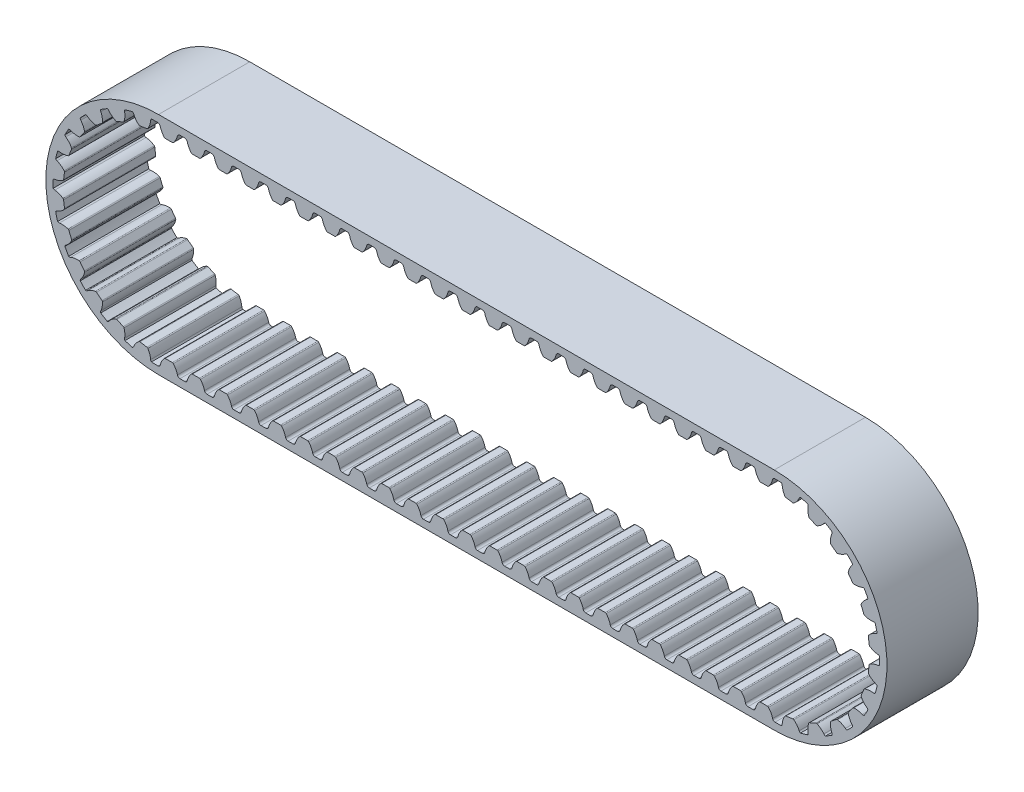
from build123d import *

# Parameters (mm, degrees)
EXTRUDE_2_DEPTH       = 10
EXTRUDE_3_DEPTH       = 10
PATTERN_CURVE_1_DEPTH = 10


# Read off the part's stored shape, not the designer's step: 曲線導出複製排列1
with BuildPart() as part:
    # 草圖2 → 填料-伸長2 (new body)
    with BuildSketch(Plane.XY):
        with BuildLine():
            Line((-33.75, 0.8), (33.75, 0.8))
            ThreePointArc((33.75, 0.8), (46.105, -11.555), (33.75, -23.91))
            Line((33.75, -23.91), (-33.75, -23.91))
            ThreePointArc((-33.75, -23.91), (-46.105, -11.555), (-33.75, 0.8))
        make_face()
        with BuildLine():
            Line((-33.75, 0), (33.75, 0))
            ThreePointArc((33.75, 0), (45.305, -11.555), (33.75, -23.11))
            Line((33.75, -23.11), (-33.75, -23.11))
            ThreePointArc((-33.75, -23.11), (-45.305, -11.555), (-33.75, 0))
        make_face(mode=Mode.SUBTRACT)
    extrude(amount=EXTRUDE_2_DEPTH)

    # 草圖3 → 填料-伸長3 (add)
    with BuildSketch(Plane.XY):
        with BuildLine():
            Line((-0.387655129, -1.11), (0.387655129, -1.11))
            ThreePointArc((0.387655129, -1.11), (0.449026444, -1.096870602), (0.49965418, -1.059780822))
            ThreePointArc((0.49965418, -1.059780822), (0.773682374, -0.664005968), (0.94382446, -0.213694013))
            ThreePointArc((0.94382446, -0.213694013), (1.042894551, -0.059811812), (1.215860333, 0))
            Line((1.215860333, 0), (-1.215860333, 0))
            ThreePointArc((-1.215860333, 0), (-1.042894551, -0.059811812), (-0.94382446, -0.213694013))
            ThreePointArc((-0.94382446, -0.213694013), (-0.773682374, -0.664005968), (-0.49965418, -1.059780822))
            ThreePointArc((-0.49965418, -1.059780822), (-0.449026444, -1.096870602), (-0.387655129, -1.11))
        make_face()
    extrude(amount=EXTRUDE_3_DEPTH)

    # 曲線導出複製排列1 outline → 曲線導出複製排列1 (add)
    with BuildSketch(Plane.XY):
        with BuildLine():
            ThreePointArc((3.909570264, -0.213694013), (4.008640354, -0.059811812), (4.181606137, 0))
            Line((4.181606137, 0), (1.74988547, 0))
            ThreePointArc((1.74988547, 0), (1.922851252, -0.059811812), (2.021921343, -0.213694013))
            ThreePointArc((2.021921343, -0.213694013), (2.19206343, -0.664005968), (2.466091623, -1.059780822))
            ThreePointArc((2.466091623, -1.059780822), (2.516719359, -1.096870602), (2.578090674, -1.11))
            Line((2.578090674, -1.11), (3.353400932, -1.11))
            ThreePointArc((3.353400932, -1.11), (3.414772248, -1.096870602), (3.465399984, -1.059780822))
            ThreePointArc((3.465399984, -1.059780822), (3.739428177, -0.664005968), (3.909570264, -0.213694013))
        make_face()
        with BuildLine():
            ThreePointArc((6.875316067, -0.213694013), (6.974386157, -0.059811812), (7.14735194, 0))
            Line((7.14735194, 0), (4.715631273, 0))
            ThreePointArc((4.715631273, 0), (4.888597055, -0.059811812), (4.987667146, -0.213694013))
            ThreePointArc((4.987667146, -0.213694013), (5.157809233, -0.664005968), (5.431837426, -1.059780822))
            ThreePointArc((5.431837426, -1.059780822), (5.482465162, -1.096870602), (5.543836478, -1.11))
            Line((5.543836478, -1.11), (6.319146735, -1.11))
            ThreePointArc((6.319146735, -1.11), (6.380518051, -1.096870602), (6.431145787, -1.059780822))
            ThreePointArc((6.431145787, -1.059780822), (6.70517398, -0.664005968), (6.875316067, -0.213694013))
        make_face()
        with BuildLine():
            ThreePointArc((9.84106187, -0.213694013), (9.940131961, -0.059811812), (10.113097743, 0))
            Line((10.113097743, 0), (7.681377076, 0))
            ThreePointArc((7.681377076, 0), (7.854342859, -0.059811812), (7.953412949, -0.213694013))
            ThreePointArc((7.953412949, -0.213694013), (8.123555036, -0.664005968), (8.397583229, -1.059780822))
            ThreePointArc((8.397583229, -1.059780822), (8.448210965, -1.096870602), (8.509582281, -1.11))
            Line((8.509582281, -1.11), (9.284892538, -1.11))
            ThreePointArc((9.284892538, -1.11), (9.346263854, -1.096870602), (9.39689159, -1.059780822))
            ThreePointArc((9.39689159, -1.059780822), (9.670919783, -0.664005968), (9.84106187, -0.213694013))
        make_face()
        with BuildLine():
            ThreePointArc((12.806807673, -0.213694013), (12.905877764, -0.059811812), (13.078843546, 0))
            Line((13.078843546, 0), (10.64712288, 0))
            ThreePointArc((10.64712288, 0), (10.820088662, -0.059811812), (10.919158752, -0.213694013))
            ThreePointArc((10.919158752, -0.213694013), (11.089300839, -0.664005968), (11.363329032, -1.059780822))
            ThreePointArc((11.363329032, -1.059780822), (11.413956768, -1.096870602), (11.475328084, -1.11))
            Line((11.475328084, -1.11), (12.250638342, -1.11))
            ThreePointArc((12.250638342, -1.11), (12.312009657, -1.096870602), (12.362637393, -1.059780822))
            ThreePointArc((12.362637393, -1.059780822), (12.636665586, -0.664005968), (12.806807673, -0.213694013))
        make_face()
        with BuildLine():
            ThreePointArc((15.772553476, -0.213694013), (15.871623567, -0.059811812), (16.044589349, 0))
            Line((16.044589349, 0), (13.612868683, 0))
            ThreePointArc((13.612868683, 0), (13.785834465, -0.059811812), (13.884904556, -0.213694013))
            ThreePointArc((13.884904556, -0.213694013), (14.055046643, -0.664005968), (14.329074836, -1.059780822))
            ThreePointArc((14.329074836, -1.059780822), (14.379702572, -1.096870602), (14.441073887, -1.11))
            Line((14.441073887, -1.11), (15.216384145, -1.11))
            ThreePointArc((15.216384145, -1.11), (15.27775546, -1.096870602), (15.328383196, -1.059780822))
            ThreePointArc((15.328383196, -1.059780822), (15.60241139, -0.664005968), (15.772553476, -0.213694013))
        make_face()
        with BuildLine():
            ThreePointArc((18.73829928, -0.213694013), (18.83736937, -0.059811812), (19.010335153, 0))
            Line((19.010335153, 0), (16.578614486, 0))
            ThreePointArc((16.578614486, 0), (16.751580268, -0.059811812), (16.850650359, -0.213694013))
            ThreePointArc((16.850650359, -0.213694013), (17.020792446, -0.664005968), (17.294820639, -1.059780822))
            ThreePointArc((17.294820639, -1.059780822), (17.345448375, -1.096870602), (17.40681969, -1.11))
            Line((17.40681969, -1.11), (18.182129948, -1.11))
            ThreePointArc((18.182129948, -1.11), (18.243501264, -1.096870602), (18.294129, -1.059780822))
            ThreePointArc((18.294129, -1.059780822), (18.568157193, -0.664005968), (18.73829928, -0.213694013))
        make_face()
        with BuildLine():
            ThreePointArc((21.704045083, -0.213694013), (21.803115173, -0.059811812), (21.976080956, 0))
            Line((21.976080956, 0), (19.544360289, 0))
            ThreePointArc((19.544360289, 0), (19.717326071, -0.059811812), (19.816396162, -0.213694013))
            ThreePointArc((19.816396162, -0.213694013), (19.986538249, -0.664005968), (20.260566442, -1.059780822))
            ThreePointArc((20.260566442, -1.059780822), (20.311194178, -1.096870602), (20.372565494, -1.11))
            Line((20.372565494, -1.11), (21.147875751, -1.11))
            ThreePointArc((21.147875751, -1.11), (21.209247067, -1.096870602), (21.259874803, -1.059780822))
            ThreePointArc((21.259874803, -1.059780822), (21.533902996, -0.664005968), (21.704045083, -0.213694013))
        make_face()
        with BuildLine():
            ThreePointArc((24.669790886, -0.213694013), (24.768860977, -0.059811812), (24.941826759, 0))
            Line((24.941826759, 0), (22.510106092, 0))
            ThreePointArc((22.510106092, 0), (22.683071875, -0.059811812), (22.782141965, -0.213694013))
            ThreePointArc((22.782141965, -0.213694013), (22.952284052, -0.664005968), (23.226312245, -1.059780822))
            ThreePointArc((23.226312245, -1.059780822), (23.276939981, -1.096870602), (23.338311297, -1.11))
            Line((23.338311297, -1.11), (24.113621554, -1.11))
            ThreePointArc((24.113621554, -1.11), (24.17499287, -1.096870602), (24.225620606, -1.059780822))
            ThreePointArc((24.225620606, -1.059780822), (24.499648799, -0.664005968), (24.669790886, -0.213694013))
        make_face()
        with BuildLine():
            ThreePointArc((27.635536689, -0.213694013), (27.73460678, -0.059811812), (27.907572562, 0))
            Line((27.907572562, 0), (25.475851896, 0))
            ThreePointArc((25.475851896, 0), (25.648817678, -0.059811812), (25.747887768, -0.213694013))
            ThreePointArc((25.747887768, -0.213694013), (25.918029855, -0.664005968), (26.192058048, -1.059780822))
            ThreePointArc((26.192058048, -1.059780822), (26.242685784, -1.096870602), (26.3040571, -1.11))
            Line((26.3040571, -1.11), (27.079367358, -1.11))
            ThreePointArc((27.079367358, -1.11), (27.140738673, -1.096870602), (27.191366409, -1.059780822))
            ThreePointArc((27.191366409, -1.059780822), (27.465394602, -0.664005968), (27.635536689, -0.213694013))
        make_face()
        with BuildLine():
            ThreePointArc((30.601282492, -0.213694013), (30.700352583, -0.059811812), (30.873318365, 0))
            Line((30.873318365, 0), (28.441597699, 0))
            ThreePointArc((28.441597699, 0), (28.614563481, -0.059811812), (28.713633572, -0.213694013))
            ThreePointArc((28.713633572, -0.213694013), (28.883775659, -0.664005968), (29.157803852, -1.059780822))
            ThreePointArc((29.157803852, -1.059780822), (29.208431588, -1.096870602), (29.269802903, -1.11))
            Line((29.269802903, -1.11), (30.045113161, -1.11))
            ThreePointArc((30.045113161, -1.11), (30.106484477, -1.096870602), (30.157112213, -1.059780822))
            ThreePointArc((30.157112213, -1.059780822), (30.431140406, -0.664005968), (30.601282492, -0.213694013))
        make_face()
        with BuildLine():
            ThreePointArc((33.567028296, -0.213694013), (33.661420863, -0.063567895), (33.827069714, -0.000257023))
            ThreePointArc((33.827069714, -0.000257023), (33.788535071, -6.4256e-05), (33.75, 0))
            Line((33.75, 0), (31.407343502, 0))
            ThreePointArc((31.407343502, 0), (31.580309284, -0.059811812), (31.679379375, -0.213694013))
            ThreePointArc((31.679379375, -0.213694013), (31.849521462, -0.664005968), (32.123549655, -1.059780822))
            ThreePointArc((32.123549655, -1.059780822), (32.174177391, -1.096870602), (32.235548706, -1.11))
            Line((32.235548706, -1.11), (33.010858964, -1.11))
            ThreePointArc((33.010858964, -1.11), (33.07223028, -1.096870602), (33.122858016, -1.059780822))
            ThreePointArc((33.122858016, -1.059780822), (33.396886209, -0.664005968), (33.567028296, -0.213694013))
        make_face()
        with BuildLine():
            ThreePointArc((36.479228277, -0.506591105), (36.535364864, -0.421225218), (36.618390772, -0.361682378))
            ThreePointArc((36.618390772, -0.361682378), (35.581196664, -0.146023544), (34.528610507, -0.026262399))
            ThreePointArc((34.528610507, -0.026262399), (34.588832258, -0.10879719), (34.615434067, -0.207442995))
            ThreePointArc((34.615434067, -0.207442995), (34.712062134, -0.679027773), (34.919906323, -1.113228163))
            ThreePointArc((34.919906323, -1.113228163), (34.964016403, -1.157872539), (35.022531451, -1.180561933))
            Line((35.022531451, -1.180561933), (35.788043911, -1.303430437))
            ThreePointArc((35.788043911, -1.303430437), (35.850720363, -1.300192873), (35.906586164, -1.271595116))
            ThreePointArc((35.906586164, -1.271595116), (36.23987243, -0.924248817), (36.479228277, -0.506591105))
        make_face()
        with BuildLine():
            ThreePointArc((39.194515614, -1.561338217), (39.270483831, -1.493019251), (39.365905235, -1.456503409))
            ThreePointArc((39.365905235, -1.456503409), (38.417433157, -0.984612461), (37.429729158, -0.601570477))
            ThreePointArc((37.429729158, -0.601570477), (37.467026344, -0.696689198), (37.46771504, -0.798856594))
            ThreePointArc((37.46771504, -0.798856594), (37.441463794, -1.279522859), (37.532275695, -1.752262094))
            ThreePointArc((37.532275695, -1.752262094), (37.563607649, -1.806641576), (37.614446074, -1.843442038))
            Line((37.614446074, -1.843442038), (38.323691412, -2.156614587))
            ThreePointArc((38.323691412, -2.156614587), (38.385136602, -2.16939379), (38.446432047, -2.155914623))
            ThreePointArc((38.446432047, -2.155914623), (38.85697613, -1.904552848), (39.194515614, -1.561338217))
        make_face()
        with BuildLine():
            ThreePointArc((41.553104067, -3.270822732), (41.643926834, -3.224026621), (41.745492177, -3.212930123))
            ThreePointArc((41.745492177, -3.212930123), (40.947881529, -2.515723121), (40.089769378, -1.894495395))
            ThreePointArc((40.089769378, -1.894495395), (40.101698463, -1.995966317), (40.076428927, -2.09496178))
            ThreePointArc((40.076428927, -2.09496178), (39.929018225, -2.553218554), (39.896848272, -3.033524997))
            ThreePointArc((39.896848272, -3.033524997), (39.913349378, -3.0940769), (39.953180487, -3.142577439))
            Line((39.953180487, -3.142577439), (40.559692307, -3.625536451))
            ThreePointArc((40.559692307, -3.625536451), (40.615880638, -3.653495187), (40.678589939, -3.656017701))
            ThreePointArc((40.678589939, -3.656017701), (41.139494934, -3.517108483), (41.553104067, -3.270822732))
        make_face()
        with BuildLine():
            ThreePointArc((43.400470088, -5.523047317), (43.500197129, -5.500839921), (43.60125233, -5.515889756))
            ThreePointArc((43.60125233, -5.515889756), (43.006758783, -4.639044403), (42.334457926, -3.820330834))
            ThreePointArc((42.334457926, -3.820330834), (42.320237373, -3.921506063), (42.270665145, -4.010843878))
            ThreePointArc((42.270665145, -4.010843878), (42.011752638, -4.416668347), (41.858708454, -4.873074596))
            ThreePointArc((41.858708454, -4.873074596), (41.859297639, -4.935831845), (41.885511885, -4.992854934))
            Line((41.885511885, -4.992854934), (42.349554405, -5.613959221))
            ThreePointArc((42.349554405, -5.613959221), (42.396804683, -5.655265766), (42.456819423, -5.673624699))
            ThreePointArc((42.456819423, -5.673624699), (42.937889018, -5.656268712), (43.400470088, -5.523047317))
        make_face()
        with BuildLine():
            ThreePointArc((44.615583002, -8.170456881), (44.717680673, -8.174293124), (44.811605073, -8.214503299))
            ThreePointArc((44.811605073, -8.214503299), (44.459177032, -7.215466349), (44.016733437, -6.252905174))
            ThreePointArc((44.016733437, -6.252905174), (43.977294909, -6.347156188), (43.906667726, -6.420983366))
            ThreePointArc((43.906667726, -6.420983366), (43.553216136, -6.747787832), (43.289324451, -7.150392309))
            ThreePointArc((43.289324451, -7.150392309), (43.273963114, -7.211243347), (43.284843065, -7.273053104))
            Line((43.284843065, -7.273053104), (43.576014416, -7.991610854))
            ThreePointArc((43.576014416, -7.991610854), (43.611231026, -8.043558999), (43.664619324, -8.07655156))
            ThreePointArc((43.664619324, -8.07655156), (44.134336117, -8.181885886), (44.615583002, -8.170456881))
        make_face()
        with BuildLine():
            ThreePointArc((45.118834364, -11.039605686), (45.216613708, -11.069234234), (45.297253826, -11.131970368))
            ThreePointArc((45.297253826, -11.131970368), (45.209980707, -10.076193993), (45.026381183, -9.032847663))
            ThreePointArc((45.026381183, -9.032847663), (44.964308506, -9.113999582), (44.877253528, -9.167479315))
            ThreePointArc((44.877253528, -9.167479315), (44.452419329, -9.393853097), (44.094969077, -9.716279063))
            ThreePointArc((44.094969077, -9.716279063), (44.06466362, -9.771237217), (44.059496473, -9.83378416))
            Line((44.059496473, -9.83378416), (44.158720486, -10.602718872))
            ThreePointArc((44.158720486, -10.602718872), (44.179596204, -10.66190522), (44.222860311, -10.707369893))
            ThreePointArc((44.222860311, -10.707369893), (44.650450682, -10.928493525), (45.118834364, -11.039605686))
        make_face()
        with BuildLine():
            ThreePointArc((44.877253528, -13.942520685), (44.964308506, -13.996000418), (45.026381183, -14.077152337))
            ThreePointArc((45.026381183, -14.077152337), (45.209980707, -13.033806007), (45.297253826, -11.978029632))
            ThreePointArc((45.297253826, -11.978029632), (45.216613708, -12.040765766), (45.118834364, -12.070394314))
            ThreePointArc((45.118834364, -12.070394314), (44.650450682, -12.181506475), (44.222860311, -12.402630107))
            ThreePointArc((44.222860311, -12.402630107), (44.179596204, -12.44809478), (44.158720486, -12.507281128))
            Line((44.158720486, -12.507281128), (44.059496473, -13.27621584))
            ThreePointArc((44.059496473, -13.27621584), (44.06466362, -13.338762783), (44.094969077, -13.393720937))
            ThreePointArc((44.094969077, -13.393720937), (44.452419329, -13.716146903), (44.877253528, -13.942520685))
        make_face()
        with BuildLine():
            ThreePointArc((43.906667726, -16.689016634), (43.977294909, -16.762843812), (44.016733437, -16.857094826))
            ThreePointArc((44.016733437, -16.857094826), (44.459177032, -15.894533651), (44.811605073, -14.895496701))
            ThreePointArc((44.811605073, -14.895496701), (44.717680673, -14.935706876), (44.615583002, -14.939543119))
            ThreePointArc((44.615583002, -14.939543119), (44.134336117, -14.928114114), (43.664619324, -15.03344844))
            ThreePointArc((43.664619324, -15.03344844), (43.611231026, -15.066441001), (43.576014416, -15.118389146))
            Line((43.576014416, -15.118389146), (43.284843065, -15.836946896))
            ThreePointArc((43.284843065, -15.836946896), (43.273963114, -15.898756653), (43.289324451, -15.959607691))
            ThreePointArc((43.289324451, -15.959607691), (43.553216136, -16.362212168), (43.906667726, -16.689016634))
        make_face()
        with BuildLine():
            ThreePointArc((42.270665145, -19.099156122), (42.320237373, -19.188493937), (42.334457926, -19.289669166))
            ThreePointArc((42.334457926, -19.289669166), (43.006758783, -18.470955597), (43.60125233, -17.594110244))
            ThreePointArc((43.60125233, -17.594110244), (43.500197129, -17.609160079), (43.400470088, -17.586952683))
            ThreePointArc((43.400470088, -17.586952683), (42.937889018, -17.453731288), (42.456819423, -17.436375301))
            ThreePointArc((42.456819423, -17.436375301), (42.396804683, -17.454734234), (42.349554405, -17.496040779))
            Line((42.349554405, -17.496040779), (41.885511885, -18.117145066))
            ThreePointArc((41.885511885, -18.117145066), (41.859297639, -18.174168155), (41.858708454, -18.236925404))
            ThreePointArc((41.858708454, -18.236925404), (42.011752638, -18.693331653), (42.270665145, -19.099156122))
        make_face()
        with BuildLine():
            ThreePointArc((40.076428927, -21.01503822), (40.101698463, -21.114033683), (40.089769378, -21.215504605))
            ThreePointArc((40.089769378, -21.215504605), (40.947881529, -20.594276879), (41.745492177, -19.897069877))
            ThreePointArc((41.745492177, -19.897069877), (41.643926834, -19.885973379), (41.553104067, -19.839177268))
            ThreePointArc((41.553104067, -19.839177268), (41.139494934, -19.592891517), (40.678589939, -19.453982299))
            ThreePointArc((40.678589939, -19.453982299), (40.615880638, -19.456504813), (40.559692307, -19.484463549))
            Line((40.559692307, -19.484463549), (39.953180487, -19.967422561))
            ThreePointArc((39.953180487, -19.967422561), (39.913349378, -20.0159231), (39.896848272, -20.076475003))
            ThreePointArc((39.896848272, -20.076475003), (39.929018225, -20.556781446), (40.076428927, -21.01503822))
        make_face()
        with BuildLine():
            ThreePointArc((37.46771504, -22.311143406), (37.467026344, -22.413310802), (37.429729158, -22.508429523))
            ThreePointArc((37.429729158, -22.508429523), (38.417433157, -22.125387539), (39.365905235, -21.653496591))
            ThreePointArc((39.365905235, -21.653496591), (39.270483831, -21.616980749), (39.194515614, -21.548661783))
            ThreePointArc((39.194515614, -21.548661783), (38.85697613, -21.205447152), (38.446432047, -20.954085377))
            ThreePointArc((38.446432047, -20.954085377), (38.385136602, -20.94060621), (38.323691412, -20.953385413))
            Line((38.323691412, -20.953385413), (37.614446074, -21.266557962))
            ThreePointArc((37.614446074, -21.266557962), (37.563607649, -21.303358424), (37.532275695, -21.357737906))
            ThreePointArc((37.532275695, -21.357737906), (37.441463794, -21.830477141), (37.46771504, -22.311143406))
        make_face()
        with BuildLine():
            ThreePointArc((34.615434067, -22.902557005), (34.588832258, -23.00120281), (34.528610507, -23.083737601))
            ThreePointArc((34.528610507, -23.083737601), (35.581196664, -22.963976456), (36.618390772, -22.748317622))
            ThreePointArc((36.618390772, -22.748317622), (36.535364864, -22.688774782), (36.479228277, -22.603408895))
            ThreePointArc((36.479228277, -22.603408895), (36.23987243, -22.185751183), (35.906586164, -21.838404884))
            ThreePointArc((35.906586164, -21.838404884), (35.850720363, -21.809807127), (35.788043911, -21.806569563))
            Line((35.788043911, -21.806569563), (35.022531451, -21.929438067))
            ThreePointArc((35.022531451, -21.929438067), (34.964016403, -21.952127461), (34.919906323, -21.996771837))
            ThreePointArc((34.919906323, -21.996771837), (34.712062134, -22.430972227), (34.615434067, -22.902557005))
        make_face()
        with BuildLine():
            ThreePointArc((31.679379375, -22.896305987), (31.580309284, -23.050188188), (31.407343502, -23.11))
            Line((31.407343502, -23.11), (33.75, -23.11))
            ThreePointArc((33.75, -23.11), (33.788535071, -23.109935744), (33.827069714, -23.109742977))
            ThreePointArc((33.827069714, -23.109742977), (33.661420863, -23.046432105), (33.567028296, -22.896305987))
            ThreePointArc((33.567028296, -22.896305987), (33.396886209, -22.445994032), (33.122858016, -22.050219178))
            ThreePointArc((33.122858016, -22.050219178), (33.07223028, -22.013129398), (33.010858964, -22))
            Line((33.010858964, -22), (32.235548706, -22))
            ThreePointArc((32.235548706, -22), (32.174177391, -22.013129398), (32.123549655, -22.050219178))
            ThreePointArc((32.123549655, -22.050219178), (31.849521462, -22.445994032), (31.679379375, -22.896305987))
        make_face()
        with BuildLine():
            ThreePointArc((28.713633572, -22.896305987), (28.614563481, -23.050188188), (28.441597699, -23.11))
            Line((28.441597699, -23.11), (30.873318365, -23.11))
            ThreePointArc((30.873318365, -23.11), (30.700352583, -23.050188188), (30.601282492, -22.896305987))
            ThreePointArc((30.601282492, -22.896305987), (30.431140406, -22.445994032), (30.157112213, -22.050219178))
            ThreePointArc((30.157112213, -22.050219178), (30.106484477, -22.013129398), (30.045113161, -22))
            Line((30.045113161, -22), (29.269802903, -22))
            ThreePointArc((29.269802903, -22), (29.208431588, -22.013129398), (29.157803852, -22.050219178))
            ThreePointArc((29.157803852, -22.050219178), (28.883775659, -22.445994032), (28.713633572, -22.896305987))
        make_face()
        with BuildLine():
            ThreePointArc((25.747887768, -22.896305987), (25.648817678, -23.050188188), (25.475851896, -23.11))
            Line((25.475851896, -23.11), (27.907572562, -23.11))
            ThreePointArc((27.907572562, -23.11), (27.73460678, -23.050188188), (27.635536689, -22.896305987))
            ThreePointArc((27.635536689, -22.896305987), (27.465394602, -22.445994032), (27.191366409, -22.050219178))
            ThreePointArc((27.191366409, -22.050219178), (27.140738673, -22.013129398), (27.079367358, -22))
            Line((27.079367358, -22), (26.3040571, -22))
            ThreePointArc((26.3040571, -22), (26.242685784, -22.013129398), (26.192058048, -22.050219178))
            ThreePointArc((26.192058048, -22.050219178), (25.918029855, -22.445994032), (25.747887768, -22.896305987))
        make_face()
        with BuildLine():
            ThreePointArc((22.782141965, -22.896305987), (22.683071875, -23.050188188), (22.510106092, -23.11))
            Line((22.510106092, -23.11), (24.941826759, -23.11))
            ThreePointArc((24.941826759, -23.11), (24.768860977, -23.050188188), (24.669790886, -22.896305987))
            ThreePointArc((24.669790886, -22.896305987), (24.499648799, -22.445994032), (24.225620606, -22.050219178))
            ThreePointArc((24.225620606, -22.050219178), (24.17499287, -22.013129398), (24.113621554, -22))
            Line((24.113621554, -22), (23.338311297, -22))
            ThreePointArc((23.338311297, -22), (23.276939981, -22.013129398), (23.226312245, -22.050219178))
            ThreePointArc((23.226312245, -22.050219178), (22.952284052, -22.445994032), (22.782141965, -22.896305987))
        make_face()
        with BuildLine():
            ThreePointArc((19.816396162, -22.896305987), (19.717326071, -23.050188188), (19.544360289, -23.11))
            Line((19.544360289, -23.11), (21.976080956, -23.11))
            ThreePointArc((21.976080956, -23.11), (21.803115173, -23.050188188), (21.704045083, -22.896305987))
            ThreePointArc((21.704045083, -22.896305987), (21.533902996, -22.445994032), (21.259874803, -22.050219178))
            ThreePointArc((21.259874803, -22.050219178), (21.209247067, -22.013129398), (21.147875751, -22))
            Line((21.147875751, -22), (20.372565494, -22))
            ThreePointArc((20.372565494, -22), (20.311194178, -22.013129398), (20.260566442, -22.050219178))
            ThreePointArc((20.260566442, -22.050219178), (19.986538249, -22.445994032), (19.816396162, -22.896305987))
        make_face()
        with BuildLine():
            ThreePointArc((16.850650359, -22.896305987), (16.751580268, -23.050188188), (16.578614486, -23.11))
            Line((16.578614486, -23.11), (19.010335153, -23.11))
            ThreePointArc((19.010335153, -23.11), (18.83736937, -23.050188188), (18.73829928, -22.896305987))
            ThreePointArc((18.73829928, -22.896305987), (18.568157193, -22.445994032), (18.294129, -22.050219178))
            ThreePointArc((18.294129, -22.050219178), (18.243501264, -22.013129398), (18.182129948, -22))
            Line((18.182129948, -22), (17.40681969, -22))
            ThreePointArc((17.40681969, -22), (17.345448375, -22.013129398), (17.294820639, -22.050219178))
            ThreePointArc((17.294820639, -22.050219178), (17.020792446, -22.445994032), (16.850650359, -22.896305987))
        make_face()
        with BuildLine():
            ThreePointArc((13.884904556, -22.896305987), (13.785834465, -23.050188188), (13.612868683, -23.11))
            Line((13.612868683, -23.11), (16.044589349, -23.11))
            ThreePointArc((16.044589349, -23.11), (15.871623567, -23.050188188), (15.772553476, -22.896305987))
            ThreePointArc((15.772553476, -22.896305987), (15.60241139, -22.445994032), (15.328383196, -22.050219178))
            ThreePointArc((15.328383196, -22.050219178), (15.27775546, -22.013129398), (15.216384145, -22))
            Line((15.216384145, -22), (14.441073887, -22))
            ThreePointArc((14.441073887, -22), (14.379702572, -22.013129398), (14.329074836, -22.050219178))
            ThreePointArc((14.329074836, -22.050219178), (14.055046643, -22.445994032), (13.884904556, -22.896305987))
        make_face()
        with BuildLine():
            ThreePointArc((10.919158752, -22.896305987), (10.820088662, -23.050188188), (10.64712288, -23.11))
            Line((10.64712288, -23.11), (13.078843546, -23.11))
            ThreePointArc((13.078843546, -23.11), (12.905877764, -23.050188188), (12.806807673, -22.896305987))
            ThreePointArc((12.806807673, -22.896305987), (12.636665586, -22.445994032), (12.362637393, -22.050219178))
            ThreePointArc((12.362637393, -22.050219178), (12.312009657, -22.013129398), (12.250638342, -22))
            Line((12.250638342, -22), (11.475328084, -22))
            ThreePointArc((11.475328084, -22), (11.413956768, -22.013129398), (11.363329032, -22.050219178))
            ThreePointArc((11.363329032, -22.050219178), (11.089300839, -22.445994032), (10.919158752, -22.896305987))
        make_face()
        with BuildLine():
            ThreePointArc((7.953412949, -22.896305987), (7.854342859, -23.050188188), (7.681377076, -23.11))
            Line((7.681377076, -23.11), (10.113097743, -23.11))
            ThreePointArc((10.113097743, -23.11), (9.940131961, -23.050188188), (9.84106187, -22.896305987))
            ThreePointArc((9.84106187, -22.896305987), (9.670919783, -22.445994032), (9.39689159, -22.050219178))
            ThreePointArc((9.39689159, -22.050219178), (9.346263854, -22.013129398), (9.284892538, -22))
            Line((9.284892538, -22), (8.509582281, -22))
            ThreePointArc((8.509582281, -22), (8.448210965, -22.013129398), (8.397583229, -22.050219178))
            ThreePointArc((8.397583229, -22.050219178), (8.123555036, -22.445994032), (7.953412949, -22.896305987))
        make_face()
        with BuildLine():
            ThreePointArc((4.987667146, -22.896305987), (4.888597055, -23.050188188), (4.715631273, -23.11))
            Line((4.715631273, -23.11), (7.14735194, -23.11))
            ThreePointArc((7.14735194, -23.11), (6.974386157, -23.050188188), (6.875316067, -22.896305987))
            ThreePointArc((6.875316067, -22.896305987), (6.70517398, -22.445994032), (6.431145787, -22.050219178))
            ThreePointArc((6.431145787, -22.050219178), (6.380518051, -22.013129398), (6.319146735, -22))
            Line((6.319146735, -22), (5.543836478, -22))
            ThreePointArc((5.543836478, -22), (5.482465162, -22.013129398), (5.431837426, -22.050219178))
            ThreePointArc((5.431837426, -22.050219178), (5.157809233, -22.445994032), (4.987667146, -22.896305987))
        make_face()
        with BuildLine():
            ThreePointArc((2.021921343, -22.896305987), (1.922851252, -23.050188188), (1.74988547, -23.11))
            Line((1.74988547, -23.11), (4.181606137, -23.11))
            ThreePointArc((4.181606137, -23.11), (4.008640354, -23.050188188), (3.909570264, -22.896305987))
            ThreePointArc((3.909570264, -22.896305987), (3.739428177, -22.445994032), (3.465399984, -22.050219178))
            ThreePointArc((3.465399984, -22.050219178), (3.414772248, -22.013129398), (3.353400932, -22))
            Line((3.353400932, -22), (2.578090674, -22))
            ThreePointArc((2.578090674, -22), (2.516719359, -22.013129398), (2.466091623, -22.050219178))
            ThreePointArc((2.466091623, -22.050219178), (2.19206343, -22.445994032), (2.021921343, -22.896305987))
        make_face()
        with BuildLine():
            ThreePointArc((-0.94382446, -22.896305987), (-1.042894551, -23.050188188), (-1.215860333, -23.11))
            Line((-1.215860333, -23.11), (1.215860333, -23.11))
            ThreePointArc((1.215860333, -23.11), (1.042894551, -23.050188188), (0.94382446, -22.896305987))
            ThreePointArc((0.94382446, -22.896305987), (0.773682374, -22.445994032), (0.49965418, -22.050219178))
            ThreePointArc((0.49965418, -22.050219178), (0.449026444, -22.013129398), (0.387655129, -22))
            Line((0.387655129, -22), (-0.387655129, -22))
            ThreePointArc((-0.387655129, -22), (-0.449026444, -22.013129398), (-0.49965418, -22.050219178))
            ThreePointArc((-0.49965418, -22.050219178), (-0.773682374, -22.445994032), (-0.94382446, -22.896305987))
        make_face()
        with BuildLine():
            ThreePointArc((-3.909570264, -22.896305987), (-4.008640354, -23.050188188), (-4.181606137, -23.11))
            Line((-4.181606137, -23.11), (-1.74988547, -23.11))
            ThreePointArc((-1.74988547, -23.11), (-1.922851252, -23.050188188), (-2.021921343, -22.896305987))
            ThreePointArc((-2.021921343, -22.896305987), (-2.19206343, -22.445994032), (-2.466091623, -22.050219178))
            ThreePointArc((-2.466091623, -22.050219178), (-2.516719359, -22.013129398), (-2.578090674, -22))
            Line((-2.578090674, -22), (-3.353400932, -22))
            ThreePointArc((-3.353400932, -22), (-3.414772248, -22.013129398), (-3.465399984, -22.050219178))
            ThreePointArc((-3.465399984, -22.050219178), (-3.739428177, -22.445994032), (-3.909570264, -22.896305987))
        make_face()
        with BuildLine():
            ThreePointArc((-6.875316067, -22.896305987), (-6.974386157, -23.050188188), (-7.14735194, -23.11))
            Line((-7.14735194, -23.11), (-4.715631273, -23.11))
            ThreePointArc((-4.715631273, -23.11), (-4.888597055, -23.050188188), (-4.987667146, -22.896305987))
            ThreePointArc((-4.987667146, -22.896305987), (-5.157809233, -22.445994032), (-5.431837426, -22.050219178))
            ThreePointArc((-5.431837426, -22.050219178), (-5.482465162, -22.013129398), (-5.543836478, -22))
            Line((-5.543836478, -22), (-6.319146735, -22))
            ThreePointArc((-6.319146735, -22), (-6.380518051, -22.013129398), (-6.431145787, -22.050219178))
            ThreePointArc((-6.431145787, -22.050219178), (-6.70517398, -22.445994032), (-6.875316067, -22.896305987))
        make_face()
        with BuildLine():
            ThreePointArc((-9.84106187, -22.896305987), (-9.940131961, -23.050188188), (-10.113097743, -23.11))
            Line((-10.113097743, -23.11), (-7.681377076, -23.11))
            ThreePointArc((-7.681377076, -23.11), (-7.854342859, -23.050188188), (-7.953412949, -22.896305987))
            ThreePointArc((-7.953412949, -22.896305987), (-8.123555036, -22.445994032), (-8.397583229, -22.050219178))
            ThreePointArc((-8.397583229, -22.050219178), (-8.448210965, -22.013129398), (-8.509582281, -22))
            Line((-8.509582281, -22), (-9.284892538, -22))
            ThreePointArc((-9.284892538, -22), (-9.346263854, -22.013129398), (-9.39689159, -22.050219178))
            ThreePointArc((-9.39689159, -22.050219178), (-9.670919783, -22.445994032), (-9.84106187, -22.896305987))
        make_face()
        with BuildLine():
            ThreePointArc((-12.806807673, -22.896305987), (-12.905877764, -23.050188188), (-13.078843546, -23.11))
            Line((-13.078843546, -23.11), (-10.64712288, -23.11))
            ThreePointArc((-10.64712288, -23.11), (-10.820088662, -23.050188188), (-10.919158752, -22.896305987))
            ThreePointArc((-10.919158752, -22.896305987), (-11.089300839, -22.445994032), (-11.363329032, -22.050219178))
            ThreePointArc((-11.363329032, -22.050219178), (-11.413956768, -22.013129398), (-11.475328084, -22))
            Line((-11.475328084, -22), (-12.250638342, -22))
            ThreePointArc((-12.250638342, -22), (-12.312009657, -22.013129398), (-12.362637393, -22.050219178))
            ThreePointArc((-12.362637393, -22.050219178), (-12.636665586, -22.445994032), (-12.806807673, -22.896305987))
        make_face()
        with BuildLine():
            ThreePointArc((-15.772553476, -22.896305987), (-15.871623567, -23.050188188), (-16.044589349, -23.11))
            Line((-16.044589349, -23.11), (-13.612868683, -23.11))
            ThreePointArc((-13.612868683, -23.11), (-13.785834465, -23.050188188), (-13.884904556, -22.896305987))
            ThreePointArc((-13.884904556, -22.896305987), (-14.055046643, -22.445994032), (-14.329074836, -22.050219178))
            ThreePointArc((-14.329074836, -22.050219178), (-14.379702572, -22.013129398), (-14.441073887, -22))
            Line((-14.441073887, -22), (-15.216384145, -22))
            ThreePointArc((-15.216384145, -22), (-15.27775546, -22.013129398), (-15.328383196, -22.050219178))
            ThreePointArc((-15.328383196, -22.050219178), (-15.60241139, -22.445994032), (-15.772553476, -22.896305987))
        make_face()
        with BuildLine():
            ThreePointArc((-18.73829928, -22.896305987), (-18.83736937, -23.050188188), (-19.010335153, -23.11))
            Line((-19.010335153, -23.11), (-16.578614486, -23.11))
            ThreePointArc((-16.578614486, -23.11), (-16.751580268, -23.050188188), (-16.850650359, -22.896305987))
            ThreePointArc((-16.850650359, -22.896305987), (-17.020792446, -22.445994032), (-17.294820639, -22.050219178))
            ThreePointArc((-17.294820639, -22.050219178), (-17.345448375, -22.013129398), (-17.40681969, -22))
            Line((-17.40681969, -22), (-18.182129948, -22))
            ThreePointArc((-18.182129948, -22), (-18.243501264, -22.013129398), (-18.294129, -22.050219178))
            ThreePointArc((-18.294129, -22.050219178), (-18.568157193, -22.445994032), (-18.73829928, -22.896305987))
        make_face()
        with BuildLine():
            ThreePointArc((-21.704045083, -22.896305987), (-21.803115173, -23.050188188), (-21.976080956, -23.11))
            Line((-21.976080956, -23.11), (-19.544360289, -23.11))
            ThreePointArc((-19.544360289, -23.11), (-19.717326071, -23.050188188), (-19.816396162, -22.896305987))
            ThreePointArc((-19.816396162, -22.896305987), (-19.986538249, -22.445994032), (-20.260566442, -22.050219178))
            ThreePointArc((-20.260566442, -22.050219178), (-20.311194178, -22.013129398), (-20.372565494, -22))
            Line((-20.372565494, -22), (-21.147875751, -22))
            ThreePointArc((-21.147875751, -22), (-21.209247067, -22.013129398), (-21.259874803, -22.050219178))
            ThreePointArc((-21.259874803, -22.050219178), (-21.533902996, -22.445994032), (-21.704045083, -22.896305987))
        make_face()
        with BuildLine():
            ThreePointArc((-24.669790886, -22.896305987), (-24.768860977, -23.050188188), (-24.941826759, -23.11))
            Line((-24.941826759, -23.11), (-22.510106092, -23.11))
            ThreePointArc((-22.510106092, -23.11), (-22.683071875, -23.050188188), (-22.782141965, -22.896305987))
            ThreePointArc((-22.782141965, -22.896305987), (-22.952284052, -22.445994032), (-23.226312245, -22.050219178))
            ThreePointArc((-23.226312245, -22.050219178), (-23.276939981, -22.013129398), (-23.338311297, -22))
            Line((-23.338311297, -22), (-24.113621554, -22))
            ThreePointArc((-24.113621554, -22), (-24.17499287, -22.013129398), (-24.225620606, -22.050219178))
            ThreePointArc((-24.225620606, -22.050219178), (-24.499648799, -22.445994032), (-24.669790886, -22.896305987))
        make_face()
        with BuildLine():
            ThreePointArc((-27.635536689, -22.896305987), (-27.73460678, -23.050188188), (-27.907572562, -23.11))
            Line((-27.907572562, -23.11), (-25.475851896, -23.11))
            ThreePointArc((-25.475851896, -23.11), (-25.648817678, -23.050188188), (-25.747887768, -22.896305987))
            ThreePointArc((-25.747887768, -22.896305987), (-25.918029855, -22.445994032), (-26.192058048, -22.050219178))
            ThreePointArc((-26.192058048, -22.050219178), (-26.242685784, -22.013129398), (-26.3040571, -22))
            Line((-26.3040571, -22), (-27.079367358, -22))
            ThreePointArc((-27.079367358, -22), (-27.140738673, -22.013129398), (-27.191366409, -22.050219178))
            ThreePointArc((-27.191366409, -22.050219178), (-27.465394602, -22.445994032), (-27.635536689, -22.896305987))
        make_face()
        with BuildLine():
            ThreePointArc((-30.601282492, -22.896305987), (-30.700352583, -23.050188188), (-30.873318365, -23.11))
            Line((-30.873318365, -23.11), (-28.441597699, -23.11))
            ThreePointArc((-28.441597699, -23.11), (-28.614563481, -23.050188188), (-28.713633572, -22.896305987))
            ThreePointArc((-28.713633572, -22.896305987), (-28.883775659, -22.445994032), (-29.157803852, -22.050219178))
            ThreePointArc((-29.157803852, -22.050219178), (-29.208431588, -22.013129398), (-29.269802903, -22))
            Line((-29.269802903, -22), (-30.045113161, -22))
            ThreePointArc((-30.045113161, -22), (-30.106484477, -22.013129398), (-30.157112213, -22.050219178))
            ThreePointArc((-30.157112213, -22.050219178), (-30.431140406, -22.445994032), (-30.601282492, -22.896305987))
        make_face()
        with BuildLine():
            ThreePointArc((-33.567028296, -22.896305987), (-33.661420863, -23.046432105), (-33.827069714, -23.109742977))
            ThreePointArc((-33.827069714, -23.109742977), (-33.788535071, -23.109935744), (-33.75, -23.11))
            Line((-33.75, -23.11), (-31.407343502, -23.11))
            ThreePointArc((-31.407343502, -23.11), (-31.580309284, -23.050188188), (-31.679379375, -22.896305987))
            ThreePointArc((-31.679379375, -22.896305987), (-31.849521462, -22.445994032), (-32.123549655, -22.050219178))
            ThreePointArc((-32.123549655, -22.050219178), (-32.174177391, -22.013129398), (-32.235548706, -22))
            Line((-32.235548706, -22), (-33.010858964, -22))
            ThreePointArc((-33.010858964, -22), (-33.07223028, -22.013129398), (-33.122858016, -22.050219178))
            ThreePointArc((-33.122858016, -22.050219178), (-33.396886209, -22.445994032), (-33.567028296, -22.896305987))
        make_face()
        with BuildLine():
            ThreePointArc((-36.479228277, -22.603408895), (-36.535364864, -22.688774782), (-36.618390772, -22.748317622))
            ThreePointArc((-36.618390772, -22.748317622), (-35.581196664, -22.963976456), (-34.528610507, -23.083737601))
            ThreePointArc((-34.528610507, -23.083737601), (-34.588832258, -23.00120281), (-34.615434067, -22.902557005))
            ThreePointArc((-34.615434067, -22.902557005), (-34.712062134, -22.430972227), (-34.919906323, -21.996771837))
            ThreePointArc((-34.919906323, -21.996771837), (-34.964016403, -21.952127461), (-35.022531451, -21.929438067))
            Line((-35.022531451, -21.929438067), (-35.788043911, -21.806569563))
            ThreePointArc((-35.788043911, -21.806569563), (-35.850720363, -21.809807127), (-35.906586164, -21.838404884))
            ThreePointArc((-35.906586164, -21.838404884), (-36.23987243, -22.185751183), (-36.479228277, -22.603408895))
        make_face()
        with BuildLine():
            ThreePointArc((-39.194515614, -21.548661783), (-39.270483831, -21.616980749), (-39.365905235, -21.653496591))
            ThreePointArc((-39.365905235, -21.653496591), (-38.417433157, -22.125387539), (-37.429729158, -22.508429523))
            ThreePointArc((-37.429729158, -22.508429523), (-37.467026344, -22.413310802), (-37.46771504, -22.311143406))
            ThreePointArc((-37.46771504, -22.311143406), (-37.441463794, -21.830477141), (-37.532275695, -21.357737906))
            ThreePointArc((-37.532275695, -21.357737906), (-37.563607649, -21.303358424), (-37.614446074, -21.266557962))
            Line((-37.614446074, -21.266557962), (-38.323691412, -20.953385413))
            ThreePointArc((-38.323691412, -20.953385413), (-38.385136602, -20.94060621), (-38.446432047, -20.954085377))
            ThreePointArc((-38.446432047, -20.954085377), (-38.85697613, -21.205447152), (-39.194515614, -21.548661783))
        make_face()
        with BuildLine():
            ThreePointArc((-41.553104067, -19.839177268), (-41.643926834, -19.885973379), (-41.745492177, -19.897069877))
            ThreePointArc((-41.745492177, -19.897069877), (-40.947881529, -20.594276879), (-40.089769378, -21.215504605))
            ThreePointArc((-40.089769378, -21.215504605), (-40.101698463, -21.114033683), (-40.076428927, -21.01503822))
            ThreePointArc((-40.076428927, -21.01503822), (-39.929018225, -20.556781446), (-39.896848272, -20.076475003))
            ThreePointArc((-39.896848272, -20.076475003), (-39.913349378, -20.0159231), (-39.953180487, -19.967422561))
            Line((-39.953180487, -19.967422561), (-40.559692307, -19.484463549))
            ThreePointArc((-40.559692307, -19.484463549), (-40.615880638, -19.456504813), (-40.678589939, -19.453982299))
            ThreePointArc((-40.678589939, -19.453982299), (-41.139494934, -19.592891517), (-41.553104067, -19.839177268))
        make_face()
        with BuildLine():
            ThreePointArc((-43.400470088, -17.586952683), (-43.500197129, -17.609160079), (-43.60125233, -17.594110244))
            ThreePointArc((-43.60125233, -17.594110244), (-43.006758783, -18.470955597), (-42.334457926, -19.289669166))
            ThreePointArc((-42.334457926, -19.289669166), (-42.320237373, -19.188493937), (-42.270665145, -19.099156122))
            ThreePointArc((-42.270665145, -19.099156122), (-42.011752638, -18.693331653), (-41.858708454, -18.236925404))
            ThreePointArc((-41.858708454, -18.236925404), (-41.859297639, -18.174168155), (-41.885511885, -18.117145066))
            Line((-41.885511885, -18.117145066), (-42.349554405, -17.496040779))
            ThreePointArc((-42.349554405, -17.496040779), (-42.396804683, -17.454734234), (-42.456819423, -17.436375301))
            ThreePointArc((-42.456819423, -17.436375301), (-42.937889018, -17.453731288), (-43.400470088, -17.586952683))
        make_face()
        with BuildLine():
            ThreePointArc((-44.615583002, -14.939543119), (-44.717680673, -14.935706876), (-44.811605073, -14.895496701))
            ThreePointArc((-44.811605073, -14.895496701), (-44.459177032, -15.894533651), (-44.016733437, -16.857094826))
            ThreePointArc((-44.016733437, -16.857094826), (-43.977294909, -16.762843812), (-43.906667726, -16.689016634))
            ThreePointArc((-43.906667726, -16.689016634), (-43.553216136, -16.362212168), (-43.289324451, -15.959607691))
            ThreePointArc((-43.289324451, -15.959607691), (-43.273963114, -15.898756653), (-43.284843065, -15.836946896))
            Line((-43.284843065, -15.836946896), (-43.576014416, -15.118389146))
            ThreePointArc((-43.576014416, -15.118389146), (-43.611231026, -15.066441001), (-43.664619324, -15.03344844))
            ThreePointArc((-43.664619324, -15.03344844), (-44.134336117, -14.928114114), (-44.615583002, -14.939543119))
        make_face()
        with BuildLine():
            ThreePointArc((-45.118834364, -12.070394314), (-45.216613708, -12.040765766), (-45.297253826, -11.978029632))
            ThreePointArc((-45.297253826, -11.978029632), (-45.209980707, -13.033806007), (-45.026381183, -14.077152337))
            ThreePointArc((-45.026381183, -14.077152337), (-44.964308506, -13.996000418), (-44.877253528, -13.942520685))
            ThreePointArc((-44.877253528, -13.942520685), (-44.452419329, -13.716146903), (-44.094969077, -13.393720937))
            ThreePointArc((-44.094969077, -13.393720937), (-44.06466362, -13.338762783), (-44.059496473, -13.27621584))
            Line((-44.059496473, -13.27621584), (-44.158720486, -12.507281128))
            ThreePointArc((-44.158720486, -12.507281128), (-44.179596204, -12.44809478), (-44.222860311, -12.402630107))
            ThreePointArc((-44.222860311, -12.402630107), (-44.650450682, -12.181506475), (-45.118834364, -12.070394314))
        make_face()
        with BuildLine():
            ThreePointArc((-44.877253528, -9.167479315), (-44.964308506, -9.113999582), (-45.026381183, -9.032847663))
            ThreePointArc((-45.026381183, -9.032847663), (-45.209980707, -10.076193993), (-45.297253826, -11.131970368))
            ThreePointArc((-45.297253826, -11.131970368), (-45.216613708, -11.069234234), (-45.118834364, -11.039605686))
            ThreePointArc((-45.118834364, -11.039605686), (-44.650450682, -10.928493525), (-44.222860311, -10.707369893))
            ThreePointArc((-44.222860311, -10.707369893), (-44.179596204, -10.66190522), (-44.158720486, -10.602718872))
            Line((-44.158720486, -10.602718872), (-44.059496473, -9.83378416))
            ThreePointArc((-44.059496473, -9.83378416), (-44.06466362, -9.771237217), (-44.094969077, -9.716279063))
            ThreePointArc((-44.094969077, -9.716279063), (-44.452419329, -9.393853097), (-44.877253528, -9.167479315))
        make_face()
        with BuildLine():
            ThreePointArc((-43.906667726, -6.420983366), (-43.977294909, -6.347156188), (-44.016733437, -6.252905174))
            ThreePointArc((-44.016733437, -6.252905174), (-44.459177032, -7.215466349), (-44.811605073, -8.214503299))
            ThreePointArc((-44.811605073, -8.214503299), (-44.717680673, -8.174293124), (-44.615583002, -8.170456881))
            ThreePointArc((-44.615583002, -8.170456881), (-44.134336117, -8.181885886), (-43.664619324, -8.07655156))
            ThreePointArc((-43.664619324, -8.07655156), (-43.611231026, -8.043558999), (-43.576014416, -7.991610854))
            Line((-43.576014416, -7.991610854), (-43.284843065, -7.273053104))
            ThreePointArc((-43.284843065, -7.273053104), (-43.273963114, -7.211243347), (-43.289324451, -7.150392309))
            ThreePointArc((-43.289324451, -7.150392309), (-43.553216136, -6.747787832), (-43.906667726, -6.420983366))
        make_face()
        with BuildLine():
            ThreePointArc((-42.270665145, -4.010843878), (-42.320237373, -3.921506063), (-42.334457926, -3.820330834))
            ThreePointArc((-42.334457926, -3.820330834), (-43.006758783, -4.639044403), (-43.60125233, -5.515889756))
            ThreePointArc((-43.60125233, -5.515889756), (-43.500197129, -5.500839921), (-43.400470088, -5.523047317))
            ThreePointArc((-43.400470088, -5.523047317), (-42.937889018, -5.656268712), (-42.456819423, -5.673624699))
            ThreePointArc((-42.456819423, -5.673624699), (-42.396804683, -5.655265766), (-42.349554405, -5.613959221))
            Line((-42.349554405, -5.613959221), (-41.885511885, -4.992854934))
            ThreePointArc((-41.885511885, -4.992854934), (-41.859297639, -4.935831845), (-41.858708454, -4.873074596))
            ThreePointArc((-41.858708454, -4.873074596), (-42.011752638, -4.416668347), (-42.270665145, -4.010843878))
        make_face()
        with BuildLine():
            ThreePointArc((-40.076428927, -2.09496178), (-40.101698463, -1.995966317), (-40.089769378, -1.894495395))
            ThreePointArc((-40.089769378, -1.894495395), (-40.947881529, -2.515723121), (-41.745492177, -3.212930123))
            ThreePointArc((-41.745492177, -3.212930123), (-41.643926834, -3.224026621), (-41.553104067, -3.270822732))
            ThreePointArc((-41.553104067, -3.270822732), (-41.139494934, -3.517108483), (-40.678589939, -3.656017701))
            ThreePointArc((-40.678589939, -3.656017701), (-40.615880638, -3.653495187), (-40.559692307, -3.625536451))
            Line((-40.559692307, -3.625536451), (-39.953180487, -3.142577439))
            ThreePointArc((-39.953180487, -3.142577439), (-39.913349378, -3.0940769), (-39.896848272, -3.033524997))
            ThreePointArc((-39.896848272, -3.033524997), (-39.929018225, -2.553218554), (-40.076428927, -2.09496178))
        make_face()
        with BuildLine():
            ThreePointArc((-37.46771504, -0.798856594), (-37.467026344, -0.696689198), (-37.429729158, -0.601570477))
            ThreePointArc((-37.429729158, -0.601570477), (-38.417433157, -0.984612461), (-39.365905235, -1.456503409))
            ThreePointArc((-39.365905235, -1.456503409), (-39.270483831, -1.493019251), (-39.194515614, -1.561338217))
            ThreePointArc((-39.194515614, -1.561338217), (-38.85697613, -1.904552848), (-38.446432047, -2.155914623))
            ThreePointArc((-38.446432047, -2.155914623), (-38.385136602, -2.16939379), (-38.323691412, -2.156614587))
            Line((-38.323691412, -2.156614587), (-37.614446074, -1.843442038))
            ThreePointArc((-37.614446074, -1.843442038), (-37.563607649, -1.806641576), (-37.532275695, -1.752262094))
            ThreePointArc((-37.532275695, -1.752262094), (-37.441463794, -1.279522859), (-37.46771504, -0.798856594))
        make_face()
        with BuildLine():
            ThreePointArc((-34.615434067, -0.207442995), (-34.588832258, -0.10879719), (-34.528610507, -0.026262399))
            ThreePointArc((-34.528610507, -0.026262399), (-35.581196664, -0.146023544), (-36.618390772, -0.361682378))
            ThreePointArc((-36.618390772, -0.361682378), (-36.535364864, -0.421225218), (-36.479228277, -0.506591105))
            ThreePointArc((-36.479228277, -0.506591105), (-36.23987243, -0.924248817), (-35.906586164, -1.271595116))
            ThreePointArc((-35.906586164, -1.271595116), (-35.850720363, -1.300192873), (-35.788043911, -1.303430437))
            Line((-35.788043911, -1.303430437), (-35.022531451, -1.180561933))
            ThreePointArc((-35.022531451, -1.180561933), (-34.964016403, -1.157872539), (-34.919906323, -1.113228163))
            ThreePointArc((-34.919906323, -1.113228163), (-34.712062134, -0.679027773), (-34.615434067, -0.207442995))
        make_face()
        with BuildLine():
            ThreePointArc((-31.679379375, -0.213694013), (-31.580309284, -0.059811812), (-31.407343502, 0))
            Line((-31.407343502, 0), (-33.75, 0))
            ThreePointArc((-33.75, 0), (-33.788535071, -6.4256e-05), (-33.827069714, -0.000257023))
            ThreePointArc((-33.827069714, -0.000257023), (-33.661420863, -0.063567895), (-33.567028296, -0.213694013))
            ThreePointArc((-33.567028296, -0.213694013), (-33.396886209, -0.664005968), (-33.122858016, -1.059780822))
            ThreePointArc((-33.122858016, -1.059780822), (-33.07223028, -1.096870602), (-33.010858964, -1.11))
            Line((-33.010858964, -1.11), (-32.235548706, -1.11))
            ThreePointArc((-32.235548706, -1.11), (-32.174177391, -1.096870602), (-32.123549655, -1.059780822))
            ThreePointArc((-32.123549655, -1.059780822), (-31.849521462, -0.664005968), (-31.679379375, -0.213694013))
        make_face()
        with BuildLine():
            ThreePointArc((-28.713633572, -0.213694013), (-28.614563481, -0.059811812), (-28.441597699, 0))
            Line((-28.441597699, 0), (-30.873318365, 0))
            ThreePointArc((-30.873318365, 0), (-30.700352583, -0.059811812), (-30.601282492, -0.213694013))
            ThreePointArc((-30.601282492, -0.213694013), (-30.431140406, -0.664005968), (-30.157112213, -1.059780822))
            ThreePointArc((-30.157112213, -1.059780822), (-30.106484477, -1.096870602), (-30.045113161, -1.11))
            Line((-30.045113161, -1.11), (-29.269802903, -1.11))
            ThreePointArc((-29.269802903, -1.11), (-29.208431588, -1.096870602), (-29.157803852, -1.059780822))
            ThreePointArc((-29.157803852, -1.059780822), (-28.883775659, -0.664005968), (-28.713633572, -0.213694013))
        make_face()
        with BuildLine():
            ThreePointArc((-25.747887768, -0.213694013), (-25.648817678, -0.059811812), (-25.475851896, 0))
            Line((-25.475851896, 0), (-27.907572562, 0))
            ThreePointArc((-27.907572562, 0), (-27.73460678, -0.059811812), (-27.635536689, -0.213694013))
            ThreePointArc((-27.635536689, -0.213694013), (-27.465394602, -0.664005968), (-27.191366409, -1.059780822))
            ThreePointArc((-27.191366409, -1.059780822), (-27.140738673, -1.096870602), (-27.079367358, -1.11))
            Line((-27.079367358, -1.11), (-26.3040571, -1.11))
            ThreePointArc((-26.3040571, -1.11), (-26.242685784, -1.096870602), (-26.192058048, -1.059780822))
            ThreePointArc((-26.192058048, -1.059780822), (-25.918029855, -0.664005968), (-25.747887768, -0.213694013))
        make_face()
        with BuildLine():
            ThreePointArc((-22.782141965, -0.213694013), (-22.683071875, -0.059811812), (-22.510106092, 0))
            Line((-22.510106092, 0), (-24.941826759, 0))
            ThreePointArc((-24.941826759, 0), (-24.768860977, -0.059811812), (-24.669790886, -0.213694013))
            ThreePointArc((-24.669790886, -0.213694013), (-24.499648799, -0.664005968), (-24.225620606, -1.059780822))
            ThreePointArc((-24.225620606, -1.059780822), (-24.17499287, -1.096870602), (-24.113621554, -1.11))
            Line((-24.113621554, -1.11), (-23.338311297, -1.11))
            ThreePointArc((-23.338311297, -1.11), (-23.276939981, -1.096870602), (-23.226312245, -1.059780822))
            ThreePointArc((-23.226312245, -1.059780822), (-22.952284052, -0.664005968), (-22.782141965, -0.213694013))
        make_face()
        with BuildLine():
            ThreePointArc((-19.816396162, -0.213694013), (-19.717326071, -0.059811812), (-19.544360289, 0))
            Line((-19.544360289, 0), (-21.976080956, 0))
            ThreePointArc((-21.976080956, 0), (-21.803115173, -0.059811812), (-21.704045083, -0.213694013))
            ThreePointArc((-21.704045083, -0.213694013), (-21.533902996, -0.664005968), (-21.259874803, -1.059780822))
            ThreePointArc((-21.259874803, -1.059780822), (-21.209247067, -1.096870602), (-21.147875751, -1.11))
            Line((-21.147875751, -1.11), (-20.372565494, -1.11))
            ThreePointArc((-20.372565494, -1.11), (-20.311194178, -1.096870602), (-20.260566442, -1.059780822))
            ThreePointArc((-20.260566442, -1.059780822), (-19.986538249, -0.664005968), (-19.816396162, -0.213694013))
        make_face()
        with BuildLine():
            ThreePointArc((-16.850650359, -0.213694013), (-16.751580268, -0.059811812), (-16.578614486, 0))
            Line((-16.578614486, 0), (-19.010335153, 0))
            ThreePointArc((-19.010335153, 0), (-18.83736937, -0.059811812), (-18.73829928, -0.213694013))
            ThreePointArc((-18.73829928, -0.213694013), (-18.568157193, -0.664005968), (-18.294129, -1.059780822))
            ThreePointArc((-18.294129, -1.059780822), (-18.243501264, -1.096870602), (-18.182129948, -1.11))
            Line((-18.182129948, -1.11), (-17.40681969, -1.11))
            ThreePointArc((-17.40681969, -1.11), (-17.345448375, -1.096870602), (-17.294820639, -1.059780822))
            ThreePointArc((-17.294820639, -1.059780822), (-17.020792446, -0.664005968), (-16.850650359, -0.213694013))
        make_face()
        with BuildLine():
            ThreePointArc((-13.884904556, -0.213694013), (-13.785834465, -0.059811812), (-13.612868683, 0))
            Line((-13.612868683, 0), (-16.044589349, 0))
            ThreePointArc((-16.044589349, 0), (-15.871623567, -0.059811812), (-15.772553476, -0.213694013))
            ThreePointArc((-15.772553476, -0.213694013), (-15.60241139, -0.664005968), (-15.328383196, -1.059780822))
            ThreePointArc((-15.328383196, -1.059780822), (-15.27775546, -1.096870602), (-15.216384145, -1.11))
            Line((-15.216384145, -1.11), (-14.441073887, -1.11))
            ThreePointArc((-14.441073887, -1.11), (-14.379702572, -1.096870602), (-14.329074836, -1.059780822))
            ThreePointArc((-14.329074836, -1.059780822), (-14.055046643, -0.664005968), (-13.884904556, -0.213694013))
        make_face()
        with BuildLine():
            ThreePointArc((-10.919158752, -0.213694013), (-10.820088662, -0.059811812), (-10.64712288, 0))
            Line((-10.64712288, 0), (-13.078843546, 0))
            ThreePointArc((-13.078843546, 0), (-12.905877764, -0.059811812), (-12.806807673, -0.213694013))
            ThreePointArc((-12.806807673, -0.213694013), (-12.636665586, -0.664005968), (-12.362637393, -1.059780822))
            ThreePointArc((-12.362637393, -1.059780822), (-12.312009657, -1.096870602), (-12.250638342, -1.11))
            Line((-12.250638342, -1.11), (-11.475328084, -1.11))
            ThreePointArc((-11.475328084, -1.11), (-11.413956768, -1.096870602), (-11.363329032, -1.059780822))
            ThreePointArc((-11.363329032, -1.059780822), (-11.089300839, -0.664005968), (-10.919158752, -0.213694013))
        make_face()
        with BuildLine():
            ThreePointArc((-7.953412949, -0.213694013), (-7.854342859, -0.059811812), (-7.681377076, 0))
            Line((-7.681377076, 0), (-10.113097743, 0))
            ThreePointArc((-10.113097743, 0), (-9.940131961, -0.059811812), (-9.84106187, -0.213694013))
            ThreePointArc((-9.84106187, -0.213694013), (-9.670919783, -0.664005968), (-9.39689159, -1.059780822))
            ThreePointArc((-9.39689159, -1.059780822), (-9.346263854, -1.096870602), (-9.284892538, -1.11))
            Line((-9.284892538, -1.11), (-8.509582281, -1.11))
            ThreePointArc((-8.509582281, -1.11), (-8.448210965, -1.096870602), (-8.397583229, -1.059780822))
            ThreePointArc((-8.397583229, -1.059780822), (-8.123555036, -0.664005968), (-7.953412949, -0.213694013))
        make_face()
        with BuildLine():
            ThreePointArc((-4.987667146, -0.213694013), (-4.888597055, -0.059811812), (-4.715631273, 0))
            Line((-4.715631273, 0), (-7.14735194, 0))
            ThreePointArc((-7.14735194, 0), (-6.974386157, -0.059811812), (-6.875316067, -0.213694013))
            ThreePointArc((-6.875316067, -0.213694013), (-6.70517398, -0.664005968), (-6.431145787, -1.059780822))
            ThreePointArc((-6.431145787, -1.059780822), (-6.380518051, -1.096870602), (-6.319146735, -1.11))
            Line((-6.319146735, -1.11), (-5.543836478, -1.11))
            ThreePointArc((-5.543836478, -1.11), (-5.482465162, -1.096870602), (-5.431837426, -1.059780822))
            ThreePointArc((-5.431837426, -1.059780822), (-5.157809233, -0.664005968), (-4.987667146, -0.213694013))
        make_face()
        with BuildLine():
            Line((-3.353400932, -1.11), (-2.578090674, -1.11))
            ThreePointArc((-2.578090674, -1.11), (-2.516719359, -1.096870602), (-2.466091623, -1.059780822))
            ThreePointArc((-2.466091623, -1.059780822), (-2.19206343, -0.664005968), (-2.021921343, -0.213694013))
            ThreePointArc((-2.021921343, -0.213694013), (-1.922851252, -0.059811812), (-1.74988547, 0))
            Line((-1.74988547, 0), (-4.181606137, 0))
            ThreePointArc((-4.181606137, 0), (-4.008640354, -0.059811812), (-3.909570264, -0.213694013))
            ThreePointArc((-3.909570264, -0.213694013), (-3.739428177, -0.664005968), (-3.465399984, -1.059780822))
            ThreePointArc((-3.465399984, -1.059780822), (-3.414772248, -1.096870602), (-3.353400932, -1.11))
        make_face()
    extrude(amount=PATTERN_CURVE_1_DEPTH)


solid = part.part
